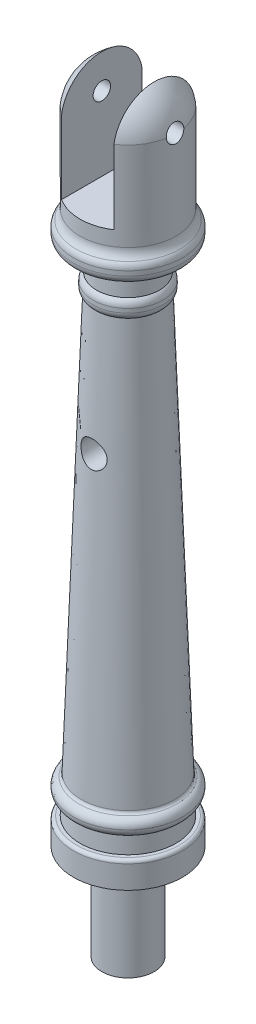
from build123d import *

# Parameters (mm, degrees)
SKETCH2_R               = 12.5
BOSS_EXTRUDE1_DEPTH     = 6
BOSS_EXTRUDE2_START     = -12
SKETCH3_R               = 12.5
BOSS_EXTRUDE2_DEPTH     = 2
FILLET1_R               = 2
FILLET2_R               = 0.75
SKETCH4_R               = 6
BOSS_EXTRUDE3_DEPTH     = 22
CUT_EXTRUDE1_START      = -15
CUT_EXTRUDE1_DEPTH      = 15
BOSS_EXTRUDE4_START     = -8
SKETCH6_R               = 8
BOSS_EXTRUDE4_DEPTH     = 2
FILLET3_R               = 2
SKETCH7_R               = 12.5
BOSS_EXTRUDE5_DEPTH     = 5
SKETCH8_R               = 11
BOSS_EXTRUDE6_DEPTH     = 22
FILLET4_R               = 2
FILLET5_R               = 3
FILLET6_R               = 0.75
CUT_EXTRUDE2_DEPTH      = 152.535125655
CUT_EXTRUDE2_DEPTH_BACK = 152.535125655
SKETCH10_W              = 12
SKETCH10_H              = 28
CUT_EXTRUDE3_DEPTH      = 150.832528731
CUT_EXTRUDE3_DEPTH_BACK = 150.832528731
SKETCH11_R              = 3
CUT_EXTRUDE4_DEPTH      = 150.832528731
CUT_EXTRUDE4_DEPTH_BACK = 150.832528731
SKETCH12_R              = 2


with BuildPart() as part:
    # Sketch1 → Revolve1 (revolve)
    with BuildSketch(Plane.XY, mode=Mode.PRIVATE) as revolve1_sk:
        Polygon((0, 0), (0, 114), (7, 114), (11, 0), align=None)
    revolve(revolve1_sk.sketch.rotate(Axis((0, 0, 0), (0, 1, 0)), 90), axis=Axis((0, 0, 0), (0, 1, 0)))

    # Sketch2 → Boss-Extrude1 (add)
    with BuildSketch(Plane.XZ):
        with Locations(Location((0, 0, 0), (0, 0, 270))):
            Circle(SKETCH2_R)
    extrude(amount=BOSS_EXTRUDE1_DEPTH)

    # Sketch3 → Boss-Extrude2 (add, symmetric)
    with BuildSketch(Plane.XZ.offset(6).offset(BOSS_EXTRUDE2_START)):
        with Locations(Location((0, 0, 0), (0, 0, 270))):
            Circle(SKETCH3_R)
    extrude(amount=BOSS_EXTRUDE2_DEPTH, both=True)

    # Fillet1
    # the kernel refuses this fillet: 2 mm, written as the material it takes off along each edge
    with BuildSketch(Plane(origin=(0, 8, 0), x_dir=(0, 0, -1), z_dir=(-1, 0, 0))) as fillet1_piece_1:
        with BuildLine():
            CenterArc((10.5, 1.987940713), FILLET1_R, 276.295089439, 83.704910561)
            Line((10.719298246, 0), (10.723684211, -0.039758814))
            ThreePointArc((10.723684211, -0.039758814), (11.609649123, -0.04), (12.5, -0.04))
            Line((12.5, -0.04), (12.54, 0))
            Line((12.54, 0), (12.54, 1.987940713))
            Line((12.54, 1.987940713), (12.5, 1.987940713))
        make_face()
    revolve(axis=Axis((0, 8, 0), (0, -1, 0)), mode=Mode.SUBTRACT)
    with BuildSketch(Plane(origin=(0, 4, 0), x_dir=(0, 0, -1), z_dir=(-1, 0, 0))) as fillet1_piece_2:
        with BuildLine():
            CenterArc((10.5, -1.967397395), FILLET1_R, 0, 79.640458827)
            Line((12.5, -1.967397395), (12.54, -1.967397395))
            Line((12.54, -1.967397395), (12.54, 0))
            Line((12.54, 0), (12.5, 0.04))
            ThreePointArc((12.5, 0.04), (11.679824561, 0.04), (10.866842105, 0.039347948))
            Line((10.866842105, 0.039347948), (10.859649123, 0))
        make_face()
    revolve(axis=Axis((0, 4, 0), (0, -1, 0)), mode=Mode.SUBTRACT)

    # Fillet2
    fillet2_edges = [part.edges().sort_by_distance(p)[0] for p in [
        (0, 0, 12.5),
    ]]
    fillet(fillet2_edges, radius=FILLET2_R)

    # Sketch4 → Boss-Extrude3 (add)
    with BuildSketch(Plane.XZ.offset(6)):
        with Locations(Location((0, 0, 0), (0, 0, 270))):
            Circle(SKETCH4_R)
    extrude(amount=BOSS_EXTRUDE3_DEPTH)

    # Sketch5 → Cut-Extrude1 (cut)
    with BuildSketch(Plane.XZ.offset(28).offset(CUT_EXTRUDE1_START)):
        with BuildLine():
            Line((-5, 3.31662479), (-5, -3.31662479))
            ThreePointArc((-5, -3.31662479), (-6, 0), (-5, 3.31662479))
        make_face()
    extrude(amount=CUT_EXTRUDE1_DEPTH, mode=Mode.SUBTRACT)

    # Sketch6 → Boss-Extrude4 (add, symmetric)
    with BuildSketch(Plane(origin=(0, 114, 0), x_dir=(1, 0, 0), z_dir=(0, 1, 0)).offset(BOSS_EXTRUDE4_START)):
        with Locations(Location((0, 0, 0), (0, 0, 270))):
            Circle(SKETCH6_R)
    extrude(amount=BOSS_EXTRUDE4_DEPTH, both=True)

    # Fillet3
    # the kernel refuses this fillet: 2 mm, written as the material it takes off along each edge
    with BuildSketch(Plane(origin=(0, 104, 0), x_dir=(0, 0, 1), z_dir=(-1, 0, 0))) as fillet3_piece_1:
        with BuildLine():
            CenterArc((6, 1.474832468), FILLET3_R, 312.488219007, 47.511780993)
            Line((8, 1.474832468), (8.04, 1.474832468))
            Line((8.04, 1.474832468), (8.04, 0))
            Line((8.04, 0), (8, -0.04))
            ThreePointArc((8, -0.04), (7.675438596, -0.04), (7.377894737, -0.029496649))
            Line((7.377894737, -0.029496649), (7.350877193, 0))
        make_face()
    revolve(axis=Axis((0, 104, 0), (0, 1, 0)), mode=Mode.SUBTRACT)
    with BuildSketch(Plane(origin=(0, 108, 0), x_dir=(0, 0, 1), z_dir=(-1, 0, 0))) as fillet3_piece_2:
        with BuildLine():
            CenterArc((6, -1.592050891), FILLET3_R, 0, 52.752219104)
            Line((7.210526316, 0), (7.234736842, 0.031841018))
            ThreePointArc((7.234736842, 0.031841018), (7.605263158, 0.04), (8, 0.04))
            Line((8, 0.04), (8.04, 0))
            Line((8.04, 0), (8.04, -1.592050891))
            Line((8.04, -1.592050891), (8, -1.592050891))
        make_face()
    revolve(axis=Axis((0, 108, 0), (0, 1, 0)), mode=Mode.SUBTRACT)

    # Sketch7 → Boss-Extrude5 (add)
    with BuildSketch(Plane(origin=(0, 114, 0), x_dir=(1, 0, 0), z_dir=(0, 1, 0))):
        with Locations(Location((0, 0, 0), (0, 0, 90))):
            Circle(SKETCH7_R)
    extrude(amount=BOSS_EXTRUDE5_DEPTH)

    # Sketch8 → Boss-Extrude6 (add)
    with BuildSketch(Plane(origin=(0, 119, 0), x_dir=(1, 0, 0), z_dir=(0, 1, 0))):
        with Locations(Location((0, 0, 0), (0, 0, 270))):
            Circle(SKETCH8_R)
    extrude(amount=BOSS_EXTRUDE6_DEPTH)

    # Fillet4
    # the kernel refuses this fillet: 2 mm, written as the material it takes off along each edge
    with BuildSketch(Plane(origin=(0, 114, 0), x_dir=(0, 0, -1), z_dir=(1, 0, 0))) as fillet4_piece_1:
        with BuildLine():
            CenterArc((12.5 - FILLET4_R, FILLET4_R), FILLET4_R, 270, 90)
            Line((12.5 - FILLET4_R, 0), (12.5 - FILLET4_R, -FILLET4_R * 0.02))
            Line((12.5 - FILLET4_R, -FILLET4_R * 0.02), (12.5 + FILLET4_R * 0.02, -FILLET4_R * 0.02))
            Line((12.5 + FILLET4_R * 0.02, -FILLET4_R * 0.02), (12.5 + FILLET4_R * 0.02, FILLET4_R))
            Line((12.5 + FILLET4_R * 0.02, FILLET4_R), (12.5, FILLET4_R))
        make_face()
    revolve(axis=Axis((0, 114, 0), (0, 1, 0)), mode=Mode.SUBTRACT)
    with BuildSketch(Plane(origin=(0, 119, 0), x_dir=(0, 0, -1), z_dir=(1, 0, 0))) as fillet4_piece_2:
        with BuildLine():
            CenterArc((10.5, -1.936491673), FILLET4_R, 0, 75.522487814)
            Line((11, 0), (11.01, 0.038729833))
            ThreePointArc((11.01, 0.038729833), (11.75, 0.04), (12.5, 0.04))
            Line((12.5, 0.04), (12.54, 0))
            Line((12.54, 0), (12.54, -1.936491673))
            Line((12.54, -1.936491673), (12.5, -1.936491673))
        make_face()
    revolve(axis=Axis((0, 119, 0), (0, 1, 0)), mode=Mode.SUBTRACT)

    # Fillet5
    fillet5_edges = [part.edges().sort_by_distance(p)[0] for p in [
        (-11, 119, 0),
    ]]
    fillet(fillet5_edges, radius=FILLET5_R)

    # Fillet6
    fillet6_edges = [part.edges().sort_by_distance(p)[0] for p in [
        (0, 8, 10.719298246),
    ]]
    fillet(fillet6_edges, radius=FILLET6_R)

    # Sketch9 → Revolve2 (revolve)
    with BuildSketch(Plane.XY, mode=Mode.PRIVATE) as revolve2_sk:
        with BuildLine():
            Line((11, 141), (0, 141))
            Line((0, 141), (0, 150.5))
            ThreePointArc((0, 150.5), (7.292505249, 147.825532394), (11, 141))
        make_face()
    revolve(revolve2_sk.sketch.rotate(Axis((0, 141, 0), (0, 1, 0)), 270), axis=Axis((0, 141, 0), (0, 1, 0)))

    # Sketch10 → Cut-Extrude2 (cut, two sides: drawn at the far end of the back side and taken through both)
    with BuildSketch(Plane.XY.offset(-CUT_EXTRUDE2_DEPTH_BACK)):
        with Locations((0, 138)):
            Rectangle(SKETCH10_W, SKETCH10_H)
    extrude(amount=CUT_EXTRUDE2_DEPTH + CUT_EXTRUDE2_DEPTH_BACK, mode=Mode.SUBTRACT)

    # Sketch11 → Cut-Extrude3 (cut, two sides: drawn at the far end of the back side and taken through both)
    with BuildSketch(Plane.XY.offset(-CUT_EXTRUDE3_DEPTH_BACK)):
        with Locations(Location((0, 76, 0), (0, 0, 90))):
            Circle(SKETCH11_R)
    extrude(amount=CUT_EXTRUDE3_DEPTH + CUT_EXTRUDE3_DEPTH_BACK, mode=Mode.SUBTRACT)

    # Sketch12 → Cut-Extrude4 (cut, two sides: drawn at the far end of the back side and taken through both)
    with BuildSketch(Plane(origin=(0, 0, 0), x_dir=(0, 0, -1), z_dir=(1, 0, 0)).offset(-CUT_EXTRUDE4_DEPTH_BACK)):
        with Locations((0, 141)):
            Circle(SKETCH12_R)
    extrude(amount=CUT_EXTRUDE4_DEPTH + CUT_EXTRUDE4_DEPTH_BACK, mode=Mode.SUBTRACT)


solid = part.part
